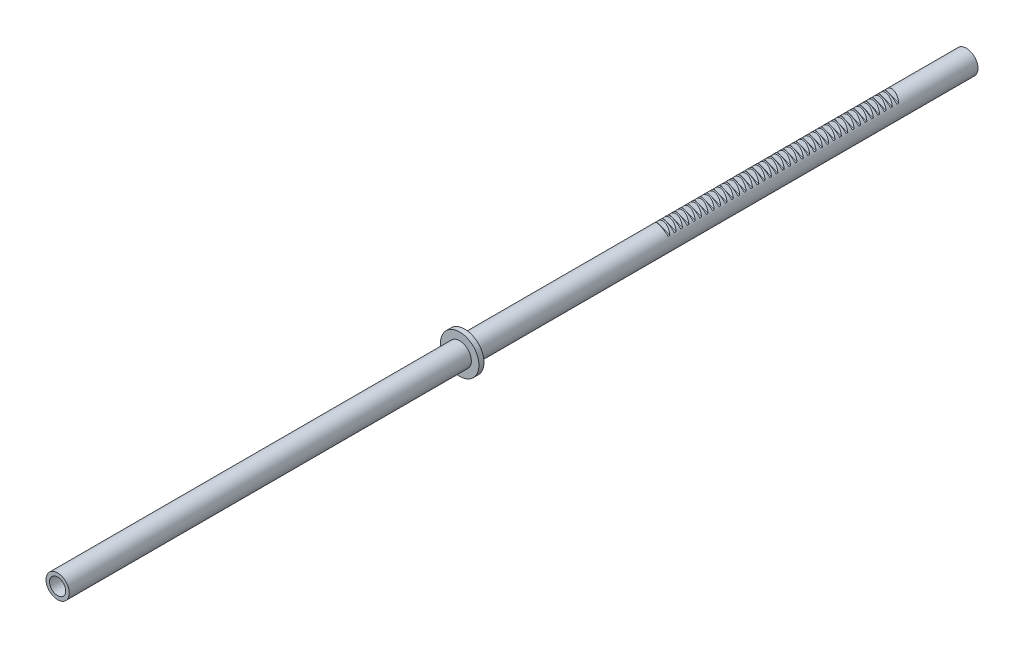
from build123d import *
from build123d.topology import SkipClean

# Parameters (mm, degrees)
SKETCH5_R            = 11.5
BOSS_EXTRUDE13_DEPTH = 598
SKETCH1_R            = 8
CUT_EXTRUDE2_DEPTH   = 17
CUT_EXTRUDE3_START   = -25
SKETCH9_R            = 8
CUT_EXTRUDE3_DEPTH   = 25
SKETCH22_R           = 29.020137942
SKETCH22_R_2         = 19
CUT_EXTRUDE4_DEPTH   = 10
SKETCH23_R           = 8
BOSS_EXTRUDE1_DEPTH  = 17
SKETCH24_R           = 11.5
BOSS_EXTRUDE2_DEPTH  = 300
SKETCH25_R           = 8
CUT_EXTRUDE5_DEPTH   = 25
BOSS_EXTRUDE3_DEPTH  = 14.86
CUT_EXTRUDE7_START   = 36
SKETCH29_R           = 21.777311072
SKETCH29_R_2         = 11.5
CUT_EXTRUDE7_DEPTH   = 36
SKETCH30_R           = 19
SKETCH30_R_2         = 11.5
CUT_EXTRUDE8_DEPTH   = 18
SKETCH27_R           = 19
BOSS_EXTRUDE9_DEPTH  = 10.03
CUT_EXTRUDE9_DEPTH   = 10.03
SKETCH35_W           = 23.953949438
SKETCH35_H           = 2.96512498
BOSS_EXTRUDE10_DEPTH = 147.5
SKETCH36_W           = 6.58
SKETCH36_H           = 5.13043091
CUT_EXTRUDE10_DEPTH  = 147.5
BOSS_EXTRUDE11_START = 5
SKETCH37_R           = 19
BOSS_EXTRUDE11_DEPTH = 5
SKETCH38_W           = 23.953949438
SKETCH38_H           = 2.96512498
CUT_EXTRUDE11_DEPTH  = 182
SKETCH39_R           = 19
SKETCH39_R_2         = 11.5
CUT_EXTRUDE12_DEPTH  = 34


with BuildPart() as part:
    # Sketch5 → Boss-Extrude13 (new body)
    with BuildSketch(Plane.XY):
        Circle(SKETCH5_R)
    extrude(amount=BOSS_EXTRUDE13_DEPTH)

    # Swept-Cut1: sweep along a path in Sketch7
    with BuildLine(Plane(origin=(0, 0, 0), x_dir=(1, 0, 0), z_dir=(0, 1, 0))) as swept_cut1_path:
        Line((11.5, -47.002601747), (-17.141789086, -39.043378107))
    # Sketch6 → Swept-Cut1 (sweep, cut)
    with BuildSketch(Plane(origin=(11.5, 0, 0), x_dir=(0, 0, -1), z_dir=(1, 0, 0))):
        Polygon((-78.362133946, 7), (-80, 11.5), (-81.283711713, 11.5), (-82.921577767, 7), (-84.645319246, 7), (-86.2831853, 11.5), (-87.566897013, 11.5), (-89.204763067, 7), (-90.928504546, 7), (-92.5663706, 11.5), (-93.850082313, 11.5), (-95.487948367, 7), (-97.211689846, 7), (-98.8495559, 11.5), (-100.133267613, 11.5), (-101.771133667, 7), (-103.494875146, 7), (-105.1327412, 11.5), (-106.416452913, 11.5), (-108.054318967, 7), (-109.778060446, 7), (-111.4159265, 11.5), (-112.699638213, 11.5), (-114.337504267, 7), (-116.061245746, 7), (-117.6991118, 11.5), (-118.982823513, 11.5), (-120.620689567, 7), (-122.344431046, 7), (-123.9822971, 11.5), (-125.266008813, 11.5), (-126.903874867, 7), (-128.627616346, 7), (-130.2654824, 11.5), (-131.549194113, 11.5), (-133.187060167, 7), (-134.910801646, 7), (-136.5486677, 11.5), (-137.832379413, 11.5), (-139.470245467, 7), (-141.193986946, 7), (-142.831853, 11.5), (-144.115564713, 11.5), (-145.753430767, 7), (-147.477172246, 7), (-149.1150383, 11.5), (-150.398750013, 11.5), (-152.036616067, 7), (-153.760357546, 7), (-155.3982236, 11.5), (-156.681935313, 11.5), (-158.319801367, 7), (-160.043542846, 7), (-161.6814089, 11.5), (-162.965120613, 11.5), (-164.602986667, 7), (-166.326728146, 7), (-167.9645942, 11.5), (-169.248305913, 11.5), (-170.886171967, 7), (-172.609913446, 7), (-174.2477795, 11.5), (-175.531491213, 11.5), (-177.169357267, 7), (-178.893098746, 7), (-180.5309648, 11.5), (-181.814676513, 11.5), (-183.452542567, 7), (-185.176284046, 7), (-186.8141501, 11.5), (-188.097861813, 11.5), (-189.735727867, 7), (-191.459469346, 7), (-193.0973354, 11.5), (-194.381047113, 11.5), (-196.018913167, 7), (-197.742654646, 7), (-199.3805207, 11.5), (-200.664232413, 11.5), (-202.302098467, 7), (-204.022098467, 7), (-206.232393599, 13.072735964), (-74.431838814, 13.072735964), (-76.642133946, 7), align=None)
    sweep(path=swept_cut1_path.line, mode=Mode.SUBTRACT)

    # Sketch11 → Revolve1 (revolve)
    with BuildSketch(Plane(origin=(0, 0, 0), x_dir=(0, 0, -1), z_dir=(1, 0, 0))):
        Polygon((-380, 19), (-380, 11.5), (-390, 11.5), (-390, 14.64168316), (-387.653886088, 15.505251056), (-388.273828958, 17.92716576), (-388.161331121, 22.925900024), (-382.5, 19), align=None)
    revolve(axis=Axis((0, 0, 0), (0, 0, 1)))

    # Sketch1 → Cut-Extrude2 (cut)
    with BuildSketch(Plane.XY.offset(598)):
        Circle(SKETCH1_R)
    extrude(amount=-CUT_EXTRUDE2_DEPTH, mode=Mode.SUBTRACT)

    # Sketch9 → Cut-Extrude3 (cut)
    with BuildSketch(Plane(origin=(0, 0, 0), x_dir=(-1, 0, 0), z_dir=(0, 0, -1)).offset(CUT_EXTRUDE3_START)):
        Circle(SKETCH9_R)
    extrude(amount=CUT_EXTRUDE3_DEPTH, mode=Mode.SUBTRACT)

    # Cut-Sweep1: sweep along a path in Çizim7<3>
    with BuildLine(Plane(origin=(0, 0, 0), x_dir=(1, 0, 0), z_dir=(0, 1, 0))) as cut_sweep1_path:
        Line((25.154101774, -50.796919528), (-17.141789086, -39.043378107))
    # Sketch14 → Cut-Sweep1 (sweep, cut)
    with BuildSketch(Plane(origin=(11.5, 0, 0), x_dir=(0, 0, -1), z_dir=(1, 0, 0))):
        Polygon((-208.577830576, 7), (-206.368790882, 13.069286677), (-256.48542589, 13.069286677), (-306.741648428, 13.069286677), (-304.532608735, 7), (-302.812608735, 7), (-301.174742681, 11.5), (-299.891030968, 11.5), (-298.253164913, 7), (-296.529423435, 7), (-294.891557381, 11.5), (-293.607845668, 11.5), (-291.969979613, 7), (-290.246238135, 7), (-288.608372081, 11.5), (-287.324660368, 11.5), (-285.686794313, 7), (-283.963052835, 7), (-282.325186781, 11.5), (-281.041475068, 11.5), (-279.403609013, 7), (-277.679867535, 7), (-276.042001481, 11.5), (-274.758289768, 11.5), (-273.120423713, 7), (-271.396682235, 7), (-269.758816181, 11.5), (-268.475104468, 11.5), (-266.837238413, 7), (-265.113496935, 7), (-263.475630881, 11.5), (-262.191919168, 11.5), (-260.554053113, 7), (-258.830311635, 7), (-257.195219655, 11.5), (-255.915219655, 11.5), (-254.280127676, 7), (-252.556386197, 7), (-250.918520143, 11.5), (-249.63480843, 11.5), (-247.996942376, 7), (-246.273200897, 7), (-244.635334843, 11.5), (-243.35162313, 11.5), (-241.713757076, 7), (-239.990015597, 7), (-238.352149543, 11.5), (-237.06843783, 11.5), (-235.430571776, 7), (-233.706830297, 7), (-232.068964243, 11.5), (-230.78525253, 11.5), (-229.147386476, 7), (-227.423644997, 7), (-225.785778943, 11.5), (-224.50206723, 11.5), (-222.864201176, 7), (-221.140459697, 7), (-219.502593643, 11.5), (-218.21888193, 11.5), (-216.581015876, 7), (-214.857274397, 7), (-213.219408343, 11.5), (-211.93569663, 11.5), (-210.297830576, 7), align=None)
    sweep(path=cut_sweep1_path.line, mode=Mode.SUBTRACT)

    # Sketch22 → Cut-Extrude4 (cut)
    with SkipClean():  # the faces are left unmerged after this step: merging them gives an invalid solid
        with BuildSketch(Plane(origin=(0, 0, 380), x_dir=(-1, 0, 0), z_dir=(0, 0, -1))):
            Circle(SKETCH22_R)
            Circle(SKETCH22_R_2, mode=Mode.SUBTRACT)
        extrude(amount=-CUT_EXTRUDE4_DEPTH, mode=Mode.SUBTRACT)

    # Sketch23 → Boss-Extrude1 (add)
    with SkipClean():  # the faces are left unmerged after this step: merging them gives an invalid solid
        with BuildSketch(Plane.XY.offset(598)):
            Circle(SKETCH23_R)
        extrude(amount=-BOSS_EXTRUDE1_DEPTH)

    # Sketch24 → Boss-Extrude2 (add)
    with SkipClean():  # the faces are left unmerged after this step: merging them gives an invalid solid
        with BuildSketch(Plane.XY.offset(598)):
            Circle(SKETCH24_R)
        extrude(amount=BOSS_EXTRUDE2_DEPTH)

    # Sketch25 → Cut-Extrude5 (cut)
    with SkipClean():  # the faces are left unmerged after this step: merging them gives an invalid solid
        with BuildSketch(Plane.XY.offset(898)):
            Circle(SKETCH25_R)
        extrude(amount=-CUT_EXTRUDE5_DEPTH, mode=Mode.SUBTRACT)

    # Sketch26 → Boss-Extrude3 (add)
    with SkipClean():  # the faces are left unmerged after this step: merging them gives an invalid solid
        with BuildSketch(Plane(origin=(0, 0, 380), x_dir=(-1, 0, 0), z_dir=(0, 0, -1))):
            with BuildLine():
                ThreePointArc((0.243811626, 18.825934841), (-13.39898566, -13.226581192), (18.827513557, 0))
                ThreePointArc((18.827513557, 0), (13.39898566, 13.226581192), (0.243811626, 18.825934841))
            make_face()
            with BuildLine():
                ThreePointArc((15.805163127, 7.71617291), (-10.992581615, -14.686603394), (1.492833529, 17.934216921))
                Line((1.492833529, 17.934216921), (15.805163127, 7.71617291))
            make_face(mode=Mode.SUBTRACT)
        extrude(amount=BOSS_EXTRUDE3_DEPTH)
    add(part.part.scale(1), mode=Mode.REPLACE)  # the faces are merged on a copy

    # Sketch29 → Cut-Extrude7 (cut)
    with SkipClean():  # the faces are left unmerged after this step: merging them gives an invalid solid
        with BuildSketch(Plane(origin=(0, 0, 380), x_dir=(-1, 0, 0), z_dir=(0, 0, -1)).offset(CUT_EXTRUDE7_START)):
            Circle(SKETCH29_R)
            Circle(SKETCH29_R_2, mode=Mode.SUBTRACT)
        extrude(amount=-CUT_EXTRUDE7_DEPTH, mode=Mode.SUBTRACT)

    # Sketch30 → Cut-Extrude8 (cut)
    with BuildSketch(Plane(origin=(0, 0, 380), x_dir=(-1, 0, 0), z_dir=(0, 0, -1))):
        Circle(SKETCH30_R)
        Circle(SKETCH30_R_2, mode=Mode.SUBTRACT)
    extrude(amount=-CUT_EXTRUDE8_DEPTH, mode=Mode.SUBTRACT)

    # Sketch27 → Boss-Extrude9 (add)
    with BuildSketch(Plane(origin=(0, 0, 631.57), x_dir=(-1, 0, 0), z_dir=(0, 0, -1))):
        Circle(SKETCH27_R)
    extrude(amount=-BOSS_EXTRUDE9_DEPTH)

    # Sketch33 → Cut-Extrude9 (cut)
    with BuildSketch(Plane.XY.offset(641.6)):
        with BuildLine():
            Line((-11.294482638, 15.278568714), (12.937932633, 15.278568714))
            ThreePointArc((12.937932633, 15.278568714), (0.821724997, 27.394776349), (-11.294482638, 15.278568714))
        make_face()
    extrude(amount=-CUT_EXTRUDE9_DEPTH, mode=Mode.SUBTRACT)

    # Sketch35 → Boss-Extrude10 (add)
    with BuildSketch(Plane.XY.offset(641.6)):
        with Locations((0.682492081, 16.761131204)):
            Rectangle(SKETCH35_W, SKETCH35_H)
    extrude(amount=-BOSS_EXTRUDE10_DEPTH)

    # Sketch36 → Cut-Extrude10 (cut)
    with BuildSketch(Plane(origin=(12.6594668, 0, 0), x_dir=(0, 0, -1), z_dir=(1, 0, 0))):
        with Locations((-497.39, 17.843784169)):
            Rectangle(SKETCH36_W, SKETCH36_H)
    extrude(amount=-CUT_EXTRUDE10_DEPTH, mode=Mode.SUBTRACT)

    # Sketch37 → Boss-Extrude11 (add)
    with BuildSketch(Plane(origin=(0, 0, 500.68), x_dir=(-1, 0, 0), z_dir=(0, 0, -1)).offset(BOSS_EXTRUDE11_START)):
        Circle(SKETCH37_R)
    extrude(amount=-BOSS_EXTRUDE11_DEPTH)

    # Sketch38 → Cut-Extrude11 (cut)
    with BuildSketch(Plane(origin=(0, 0, 500.68), x_dir=(-1, 0, 0), z_dir=(0, 0, -1))):
        with Locations((-0.682492081, 16.761131204)):
            Rectangle(SKETCH38_W, SKETCH38_H)
    extrude(amount=-CUT_EXTRUDE11_DEPTH, mode=Mode.SUBTRACT)

    # Sketch39 → Cut-Extrude12 (cut)
    with BuildSketch(Plane(origin=(0, 0, 631.57), x_dir=(-1, 0, 0), z_dir=(0, 0, -1))):
        Circle(SKETCH39_R)
        Circle(SKETCH39_R_2, mode=Mode.SUBTRACT)
    extrude(amount=-CUT_EXTRUDE12_DEPTH, mode=Mode.SUBTRACT)


solid = part.part
